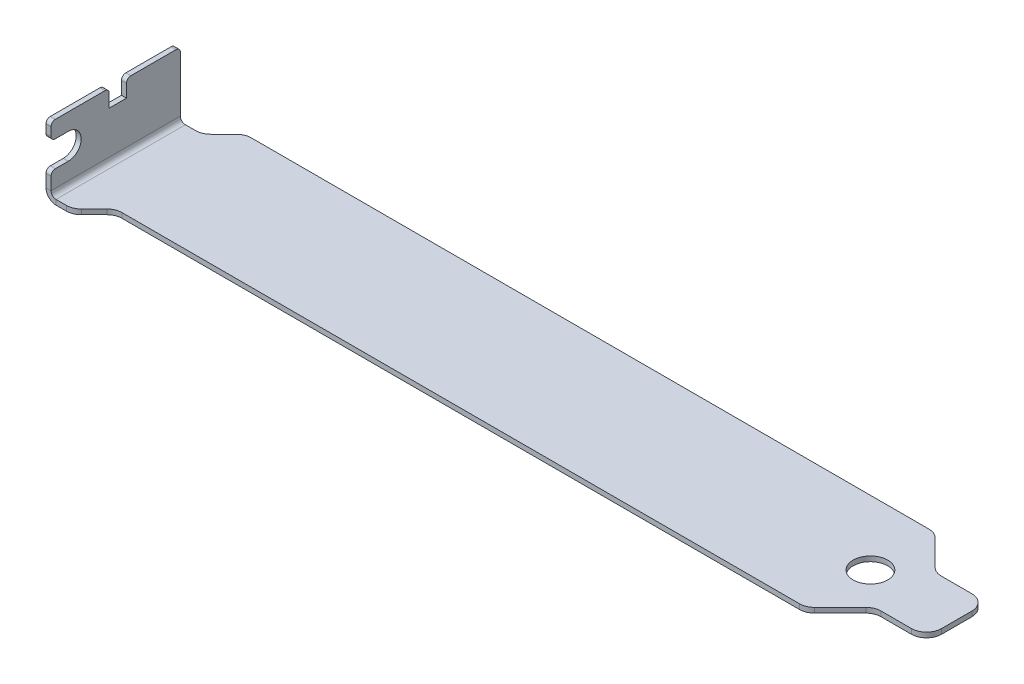
from build123d import *

# Parameters (mm, degrees)
SM_BASE_FLANGE_2_DEPTH           = 0.7366
SKETCH4_R                        = 2.54
CUT_EXTRUDE_3_DEPTH              = 116.878967374
SM_EDGE_FLANGE_4_STRIP_W         = 4.4196
SM_EDGE_FLANGE_4_STRIP_H         = 0.7366
SM_EDGE_FLANGE_4_STRIP_CUT_DEPTH = 19.05
SM_EDGE_FLANGE_4_DEPTH           = 19.05
SKETCH8_W                        = 2.54
SKETCH8_H                        = 2.54
CUT_EXTRUDE_5_DEPTH              = 123.574978827
OTHER_START                      = -7.0866
OTHER_6_DEPTH                    = 0.7366


# Read off the part's stored shape, not the designer's step: 6
# Sheet-metal steps are written as plain solids
with BuildPart() as part:
    # Sketch1 → 2 (new body)
    with BuildSketch(Plane(origin=(0, 0, 0), x_dir=(1, 0, 0), z_dir=(0, 1, 0))):
        with BuildLine():
            Line((0.920589642, 0), (100.679410358, 0))
            ThreePointArc((100.679410358, 0), (101.529924286, 0.169177739), (102.250955179, 0.650955179))
            Line((102.250955179, 0.650955179), (106.029044821, 4.429044821))
            ThreePointArc((106.029044821, 4.429044821), (106.750075714, 4.910822261), (107.600589642, 5.08))
            Line((107.600589642, 5.08), (112.0775, 5.08))
            ThreePointArc((112.0775, 5.08), (113.649044821, 5.730955179), (114.3, 7.3025))
            Line((114.3, 7.3025), (114.3, 11.7475))
            ThreePointArc((114.3, 11.7475), (113.649044821, 13.319044821), (112.0775, 13.97))
            Line((112.0775, 13.97), (107.600589642, 13.97))
            ThreePointArc((107.600589642, 13.97), (106.750075714, 14.139177739), (106.029044821, 14.620955179))
            Line((106.029044821, 14.620955179), (102.250955179, 18.399044821))
            ThreePointArc((102.250955179, 18.399044821), (101.529924286, 18.880822261), (100.679410358, 19.05))
            Line((100.679410358, 19.05), (0.920589642, 19.05))
            ThreePointArc((0.920589642, 19.05), (0.070075714, 18.880822261), (-0.650955179, 18.399044821))
            Line((-0.650955179, 18.399044821), (-2.524044821, 16.525955179))
            ThreePointArc((-2.524044821, 16.525955179), (-3.245075714, 16.044177739), (-4.095589642, 15.875))
            Line((-4.095589642, 15.875), (-6.35, 15.875))
            Line((-6.35, 15.875), (-6.35, -3.175))
            Line((-6.35, -3.175), (-4.095589642, -3.175))
            ThreePointArc((-4.095589642, -3.175), (-3.245075714, -3.005822261), (-2.524044821, -2.524044821))
            Line((-2.524044821, -2.524044821), (-0.650955179, -0.650955179))
            ThreePointArc((-0.650955179, -0.650955179), (0.070075714, -0.169177739), (0.920589642, 0))
        make_face()
    extrude(amount=SM_BASE_FLANGE_2_DEPTH)

    # Sketch4 → 3 (cut, through all)
    with BuildSketch(Plane(origin=(0, 0.7366, 0), x_dir=(-1, 0, 0), z_dir=(0, 1, 0))):
        with Locations(Location((-101.6, -9.525, 0), (0, 0, 90))):
            Circle(SKETCH4_R)
    extrude(amount=-CUT_EXTRUDE_3_DEPTH, mode=Mode.SUBTRACT)

    # 4 strip (across the edge) → 4 strip cut (cut)
    with BuildSketch(Plane(origin=(-6.35, 0.7366, -15.875), x_dir=(1, 0, 0), z_dir=(0, 0, 1))):
        with Locations((-1.4732, -0.3683)):
            Rectangle(SM_EDGE_FLANGE_4_STRIP_W, SM_EDGE_FLANGE_4_STRIP_H)
    extrude(amount=SM_EDGE_FLANGE_4_STRIP_CUT_DEPTH, mode=Mode.SUBTRACT)

    # 4 section (across the edge) → 4 (add)
    with BuildSketch(Plane(origin=(-6.35, 0.7366, -15.875), x_dir=(1, 0, 0), z_dir=(0, 0, 1))):
        with BuildLine():
            Line((-0.7366, 0.7366), (-0.7366, 9.525))
            Line((-0.7366, 9.525), (0, 9.525))
            Line((0, 9.525), (0, 0.7366))
            ThreePointArc((0, 0.7366), (0.215745145, 0.215745145), (0.7366, 0))
            Line((0.7366, 0), (0.7366, -0.7366))
            ThreePointArc((0.7366, -0.7366), (-0.30510971, -0.30510971), (-0.7366, 0.7366))
        make_face()
    extrude(amount=SM_EDGE_FLANGE_4_DEPTH)

    # Sketch8 → 5 (cut, through all)
    with BuildSketch(Plane(origin=(-6.35, 0, 0), x_dir=(0, 0, -1), z_dir=(1, 0, 0))):
        with BuildLine():
            Line((-0.635, 7.7724), (-3.175, 7.7724))
            Line((-3.175, 7.7724), (-3.175, 3.9624))
            Line((-3.175, 3.9624), (-0.635, 3.9624))
            ThreePointArc((-0.635, 3.9624), (1.27, 5.8674), (-0.635, 7.7724))
        make_face()
        with Locations((6.6675, 8.9916)):
            Rectangle(SKETCH8_W, SKETCH8_H)
    extrude(amount=-CUT_EXTRUDE_5_DEPTH, mode=Mode.SUBTRACT)

    # Other 6 outline → Other 6 (cut)
    with BuildSketch(Plane.YZ.offset(OTHER_START)):
        with BuildLine():
            ThreePointArc((3.3274, 3.175), (3.776412806, 2.989012806), (3.9624, 2.54))
            Line((3.9624, 2.54), (3.9624, 3.175))
            Line((3.9624, 3.175), (3.3274, 3.175))
        make_face()
        with BuildLine():
            ThreePointArc((7.7724, 2.54), (7.958387194, 2.989012806), (8.4074, 3.175))
            Line((8.4074, 3.175), (7.7724, 3.175))
            Line((7.7724, 3.175), (7.7724, 2.54))
        make_face()
        with BuildLine():
            Line((10.2616, -5.3975), (10.2616, -4.7625))
            ThreePointArc((10.2616, -4.7625), (10.075612806, -5.211512806), (9.6266, -5.3975))
            Line((9.6266, -5.3975), (10.2616, -5.3975))
        make_face()
        with BuildLine():
            Line((10.2616, 3.175), (9.6266, 3.175))
            ThreePointArc((9.6266, 3.175), (10.075612806, 2.989012806), (10.2616, 2.54))
            Line((10.2616, 2.54), (10.2616, 3.175))
        make_face()
        with BuildLine():
            Line((10.2616, -15.875), (10.2616, -15.24))
            ThreePointArc((10.2616, -15.24), (10.075612806, -15.689012806), (9.6266, -15.875))
            Line((9.6266, -15.875), (10.2616, -15.875))
        make_face()
        with BuildLine():
            ThreePointArc((9.6266, -7.9375), (10.075612806, -8.123487194), (10.2616, -8.5725))
            Line((10.2616, -8.5725), (10.2616, -7.9375))
            Line((10.2616, -7.9375), (9.6266, -7.9375))
        make_face()
    extrude(amount=OTHER_6_DEPTH, mode=Mode.SUBTRACT)


solid = part.part
